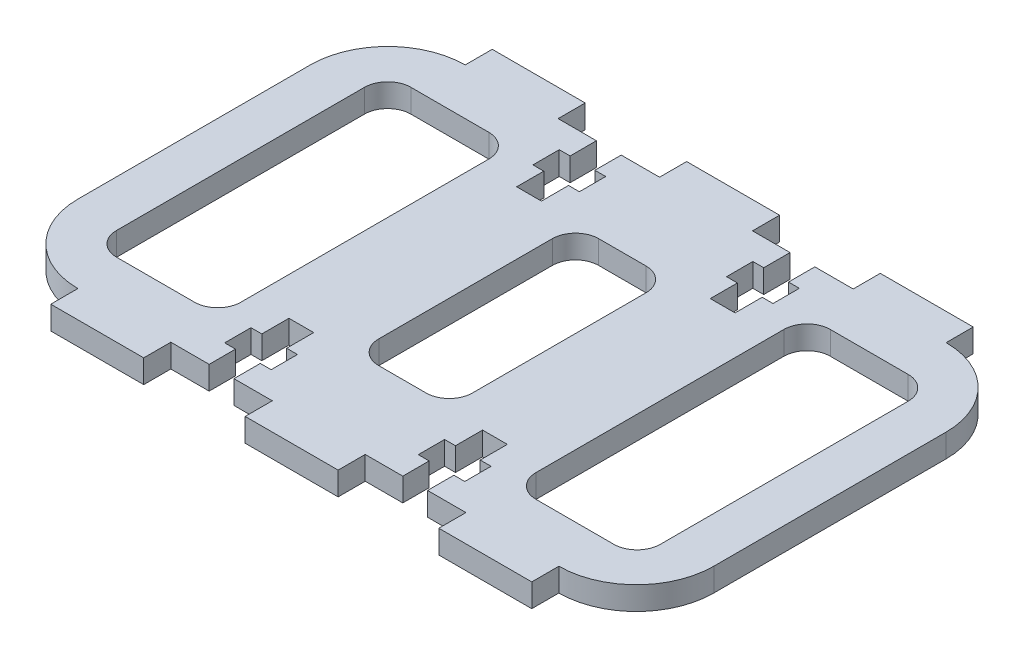
from build123d import *

# Parameters (mm, degrees)
EXTRUDE_1_DEPTH     = 3
FILLET_1_R          = 10
SKETCH_2_W          = 12.1
SKETCH_2_H          = 28.4
SKETCH_2_W_2        = 16.05
SKETCH_2_H_2        = 38
CUT_EXTRUDE_1_DEPTH = 99.039073843
FILLET_2_R          = 3


with BuildPart() as part:
    # 草图1 → 凸台-拉伸1 (new body)
    with BuildSketch(Plane(origin=(0, 0, 0), x_dir=(1, 0, 0), z_dir=(0, 1, 0))):
        Polygon((10, 0), (10, -3.5), (22, -3.5), (22, 0), (26.95, 0), (26.95, 3.4), (25.55, 3.4), (25.55, 6.8), (26.95, 6.8), (26.95, 10.3), (30.15, 10.3), (30.15, 6.8), (31.55, 6.8), (31.55, 3.4), (30.15, 3.4), (30.15, 0), (35.1, 0), (35.1, -3.5), (47.1, -3.5), (47.1, 0), (51.95, 0), (51.95, 3.4), (50.55, 3.4), (50.55, 6.8), (51.95, 6.8), (51.95, 10.3), (55.15, 10.3), (55.15, 6.8), (56.55, 6.8), (56.55, 3.4), (55.15, 3.4), (55.15, 0), (60.1, 0), (60.1, -3.5), (72.1, -3.5), (72.1, 0), (82.1, 0), (82.1, 50), (72.1, 50), (72.1, 53.5), (60.1, 53.5), (60.1, 50), (55.15, 50), (55.15, 46.6), (56.55, 46.6), (56.55, 43.2), (55.15, 43.2), (55.15, 39.7), (51.95, 39.7), (51.95, 43.2), (50.55, 43.2), (50.55, 46.6), (51.95, 46.6), (51.95, 50), (47.1, 50), (47.1, 53.5), (35.1, 53.5), (35.1, 50), (30.15, 50), (30.15, 46.6), (31.55, 46.6), (31.55, 43.2), (30.15, 43.2), (30.15, 39.7), (26.95, 39.7), (26.95, 43.2), (25.55, 43.2), (25.55, 46.6), (26.95, 46.6), (26.95, 50), (22, 50), (22, 53.5), (10, 53.5), (10, 50), (0, 50), (0, 0), align=None)
    extrude(amount=EXTRUDE_1_DEPTH)

    # 圆角1
    fillet_1_edges = [part.edges().sort_by_distance(p)[0] for p in [
        (0, 1.5, -50),
        (82.1, 1.5, -50),
        (82.1, 1.5, 0),
        (0, 1.5, 0),
    ]]
    fillet(fillet_1_edges, radius=FILLET_1_R - 0.0001)  # a hair under: the kernel refuses the full size

    # 草图2 → 切除-拉伸1 (cut, through all)
    with BuildSketch(Plane.XZ):
        with Locations((41.1, -25)):
            Rectangle(SKETCH_2_W, SKETCH_2_H)
        with Locations((14.025, -25)):
            Rectangle(SKETCH_2_W_2, SKETCH_2_H_2)
        with Locations((68.175, -25)):
            Rectangle(SKETCH_2_W_2, SKETCH_2_H_2)
    extrude(amount=-CUT_EXTRUDE_1_DEPTH, mode=Mode.SUBTRACT)

    # 圆角2
    fillet_2_edges = [part.edges().sort_by_distance(p)[0] for p in [
        (60.15, 1.5, -6),
        (76.2, 1.5, -6),
        (76.2, 1.5, -44),
        (60.15, 1.5, -44),
        (6, 1.5, -44),
        (6, 1.5, -6),
        (22.05, 1.5, -6),
        (22.05, 1.5, -44),
        (35.05, 1.5, -39.2),
        (35.05, 1.5, -10.8),
        (47.15, 1.5, -10.8),
        (47.15, 1.5, -39.2),
    ]]
    fillet(fillet_2_edges, radius=FILLET_2_R)


solid = part.part
